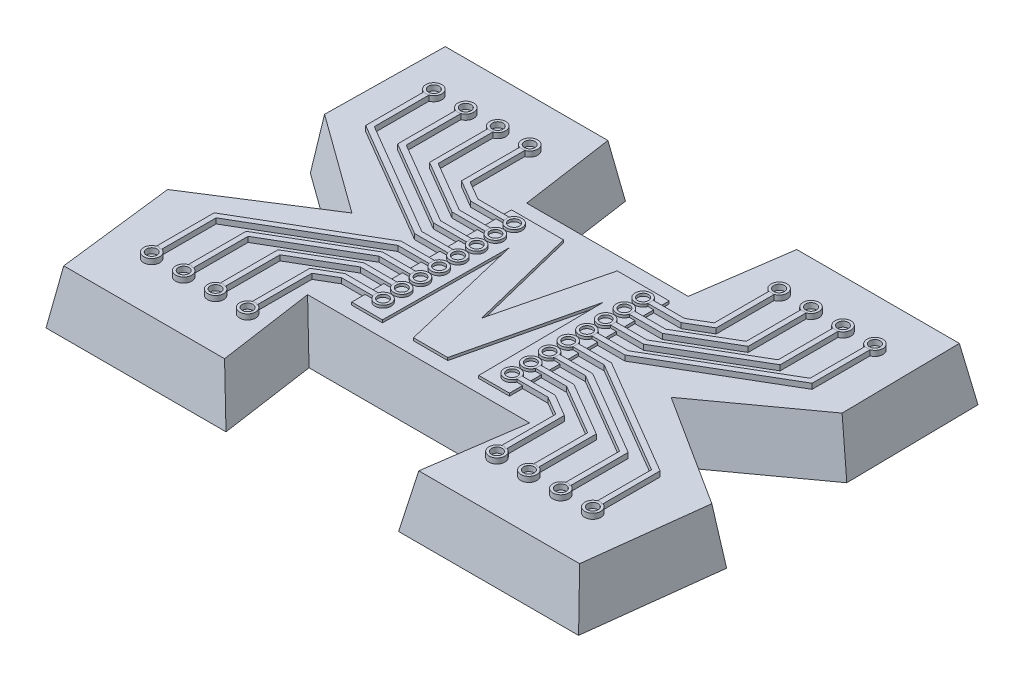
from build123d import *

# Parameters (mm, degrees)
EXTRUDE_X_DEPTH      = 20
EXTRUDE_X_TAPER      = 10
EXTRUDE_M_DEPTH      = 1
EXTRUDE_M_DEPTH_BACK = 7
M_HOLES_DEPTH        = 1
M_HOLES_DEPTH_BACK   = 3
SKETCH_9_R           = 3
SKETCH_9_R_2         = 2
HOLES_DEPTH          = 2
HOLES_DEPTH_BACK     = 4
SKETCH_8_R           = 3
SKETCH_8_R_2         = 2
HOLES_2_DEPTH        = 2
HOLES_2_DEPTH_BACK   = 4
HOLES_3_DEPTH        = 2
HOLES_3_DEPTH_BACK   = 4
HOLES_4_DEPTH        = 2
HOLES_4_DEPTH_BACK   = 4
HOLES_5_DEPTH        = 2
HOLES_5_DEPTH_BACK   = 4
HOLES_6_DEPTH        = 2
HOLES_6_DEPTH_BACK   = 4
HOLES_7_DEPTH        = 2
HOLES_7_DEPTH_BACK   = 4
HOLES_8_DEPTH        = 2
HOLES_8_DEPTH_BACK   = 4
HOLES_9_DEPTH        = 2
HOLES_9_DEPTH_BACK   = 4
HOLES_10_DEPTH       = 2
HOLES_10_DEPTH_BACK  = 4
HOLES_11_DEPTH       = 2
HOLES_11_DEPTH_BACK  = 4
HOLES_12_DEPTH       = 2
HOLES_12_DEPTH_BACK  = 4
HOLES_13_DEPTH       = 2
HOLES_13_DEPTH_BACK  = 4
HOLES_14_DEPTH       = 2
HOLES_14_DEPTH_BACK  = 4
HOLES_15_DEPTH       = 2
HOLES_15_DEPTH_BACK  = 4
HOLES_16_DEPTH       = 2
HOLES_16_DEPTH_BACK  = 4
ROUTES_DEPTH         = 2
ROUTES_2_DEPTH       = 2
ROUTES_3_DEPTH       = 2
ROUTES_4_DEPTH       = 2
ROUTES_5_DEPTH       = 2
ROUTES_6_DEPTH       = 2
ROUTES_7_DEPTH       = 2
ROUTES_8_DEPTH       = 2
ROUTES_9_DEPTH       = 2
ROUTES_10_DEPTH      = 2
ROUTES_11_DEPTH      = 2
ROUTES_12_DEPTH      = 2
ROUTES_13_DEPTH      = 2
ROUTES_14_DEPTH      = 2
ROUTES_15_DEPTH      = 2
ROUTES_16_DEPTH      = 2


with BuildPart() as part:
    # Эскиз1 → X (new body)
    with BuildSketch(Plane(origin=(0, 0, 0), x_dir=(1, 0, 0), z_dir=(0, 1, 0))):
        Polygon((0, 0), (67.599623535, 0), (62.359926215, 36.418021698), (137.640073785, 36.418021698), (132.400376465, 0), (200, 0), (205.94831436, 49.644914707), (166.200188233, 75), (200.728651396, 100.00530961), (200, 150), (132.400376465, 150), (127.274162693, 114.370734989), (72.725837307, 114.370734989), (67.599623535, 150), (0, 150), (-0.728651396, 100.00530961), (33.799811767, 75), (-5.94831436, 49.644914707), align=None)
    extrude(amount=EXTRUDE_X_DEPTH, taper=EXTRUDE_X_TAPER)



with BuildPart() as body_2:
    # Эскиз6 → M (new, two sides: drawn at the far end of the back side and taken through both)
    with BuildSketch(Plane(origin=(0, 20, 0), x_dir=(1, 0, 0), z_dir=(0, 1, 0)).offset(-EXTRUDE_M_DEPTH_BACK)):
        Polygon((70, 104.815168782), (70, 44.815168782), (81.538461538, 44.815168782), (81.923076923, 92.050745705), (93.185096154, 44.815168782), (106.045673077, 44.815168782), (117.307692308, 92.050745705), (117.692307692, 44.815168782), (129.230769231, 44.815168782), (129.230769231, 104.815168782), (109.711538462, 104.815168782), (99.615384615, 63.889688013), (89.519230769, 104.815168782), align=None)
    extrude(amount=EXTRUDE_M_DEPTH + EXTRUDE_M_DEPTH_BACK)


with BuildPart() as part_1:
    add(part.part)

    add(body_2.part)  # M holes merges body 2
    # Эскиз9 → M holes (add, two sides: drawn at the far end of the back side and taken through both)
    # profile 1 of 16: a face of its own
    with BuildSketch(Plane(origin=(0, 21, 0), x_dir=(1, 0, 0), z_dir=(0, 1, 0)).offset(-M_HOLES_DEPTH_BACK)):
        with Locations((75.769230769, 50.815168782)):
            Circle(SKETCH_9_R)
        with Locations((75.769230769, 50.815168782)):
            Circle(SKETCH_9_R_2, mode=Mode.SUBTRACT)
    # profile 2 of 16: a face of its own
    with BuildSketch(Plane(origin=(0, 21, 0), x_dir=(1, 0, 0), z_dir=(0, 1, 0)).offset(-M_HOLES_DEPTH_BACK)):
        with Locations((75.769230769, 57.841573241)):
            Circle(SKETCH_9_R)
        with Locations((75.769230769, 57.841573241)):
            Circle(SKETCH_9_R_2, mode=Mode.SUBTRACT)
    # profile 3 of 16: a face of its own
    with BuildSketch(Plane(origin=(0, 21, 0), x_dir=(1, 0, 0), z_dir=(0, 1, 0)).offset(-M_HOLES_DEPTH_BACK)):
        with Locations((75.769230769, 64.867977701)):
            Circle(SKETCH_9_R)
        with Locations((75.769230769, 64.867977701)):
            Circle(SKETCH_9_R_2, mode=Mode.SUBTRACT)
    # profile 4 of 16: a face of its own
    with BuildSketch(Plane(origin=(0, 21, 0), x_dir=(1, 0, 0), z_dir=(0, 1, 0)).offset(-M_HOLES_DEPTH_BACK)):
        with Locations((75.769230769, 71.894382161)):
            Circle(SKETCH_9_R)
        with Locations((75.769230769, 71.894382161)):
            Circle(SKETCH_9_R_2, mode=Mode.SUBTRACT)
    # profile 5 of 16: a face of its own
    with BuildSketch(Plane(origin=(0, 21, 0), x_dir=(1, 0, 0), z_dir=(0, 1, 0)).offset(-M_HOLES_DEPTH_BACK)):
        with Locations((75.769230769, 78.920786621)):
            Circle(SKETCH_9_R)
        with Locations((75.769230769, 78.920786621)):
            Circle(SKETCH_9_R_2, mode=Mode.SUBTRACT)
    # profile 6 of 16: a face of its own
    with BuildSketch(Plane(origin=(0, 21, 0), x_dir=(1, 0, 0), z_dir=(0, 1, 0)).offset(-M_HOLES_DEPTH_BACK)):
        with Locations((75.769230769, 85.94719108)):
            Circle(SKETCH_9_R)
        with Locations((75.769230769, 85.94719108)):
            Circle(SKETCH_9_R_2, mode=Mode.SUBTRACT)
    # profile 7 of 16: a face of its own
    with BuildSketch(Plane(origin=(0, 21, 0), x_dir=(1, 0, 0), z_dir=(0, 1, 0)).offset(-M_HOLES_DEPTH_BACK)):
        with Locations((75.769230769, 92.97359554)):
            Circle(SKETCH_9_R)
        with Locations((75.769230769, 92.97359554)):
            Circle(SKETCH_9_R_2, mode=Mode.SUBTRACT)
    # profile 8 of 16: a face of its own
    with BuildSketch(Plane(origin=(0, 21, 0), x_dir=(1, 0, 0), z_dir=(0, 1, 0)).offset(-M_HOLES_DEPTH_BACK)):
        with Locations((75.769230769, 100)):
            Circle(SKETCH_9_R)
        with Locations((75.769230769, 100)):
            Circle(SKETCH_9_R_2, mode=Mode.SUBTRACT)
    # profile 9 of 16: a face of its own
    with BuildSketch(Plane(origin=(0, 21, 0), x_dir=(1, 0, 0), z_dir=(0, 1, 0)).offset(-M_HOLES_DEPTH_BACK)):
        with Locations((124.230769231, 100)):
            Circle(SKETCH_9_R)
        with Locations((124.230769231, 100)):
            Circle(SKETCH_9_R_2, mode=Mode.SUBTRACT)
    # profile 10 of 16: a face of its own
    with BuildSketch(Plane(origin=(0, 21, 0), x_dir=(1, 0, 0), z_dir=(0, 1, 0)).offset(-M_HOLES_DEPTH_BACK)):
        with Locations((124.230769231, 92.97359554)):
            Circle(SKETCH_9_R)
        with Locations((124.230769231, 92.97359554)):
            Circle(SKETCH_9_R_2, mode=Mode.SUBTRACT)
    # profile 11 of 16: a face of its own
    with BuildSketch(Plane(origin=(0, 21, 0), x_dir=(1, 0, 0), z_dir=(0, 1, 0)).offset(-M_HOLES_DEPTH_BACK)):
        with Locations((124.230769231, 85.94719108)):
            Circle(SKETCH_9_R)
        with Locations((124.230769231, 85.94719108)):
            Circle(SKETCH_9_R_2, mode=Mode.SUBTRACT)
    # profile 12 of 16: a face of its own
    with BuildSketch(Plane(origin=(0, 21, 0), x_dir=(1, 0, 0), z_dir=(0, 1, 0)).offset(-M_HOLES_DEPTH_BACK)):
        with Locations((124.230769231, 78.920786621)):
            Circle(SKETCH_9_R)
        with Locations((124.230769231, 78.920786621)):
            Circle(SKETCH_9_R_2, mode=Mode.SUBTRACT)
    # profile 13 of 16: a face of its own
    with BuildSketch(Plane(origin=(0, 21, 0), x_dir=(1, 0, 0), z_dir=(0, 1, 0)).offset(-M_HOLES_DEPTH_BACK)):
        with Locations((124.230769231, 71.894382161)):
            Circle(SKETCH_9_R)
        with Locations((124.230769231, 71.894382161)):
            Circle(SKETCH_9_R_2, mode=Mode.SUBTRACT)
    # profile 14 of 16: a face of its own
    with BuildSketch(Plane(origin=(0, 21, 0), x_dir=(1, 0, 0), z_dir=(0, 1, 0)).offset(-M_HOLES_DEPTH_BACK)):
        with Locations((124.230769231, 64.867977701)):
            Circle(SKETCH_9_R)
        with Locations((124.230769231, 64.867977701)):
            Circle(SKETCH_9_R_2, mode=Mode.SUBTRACT)
    # profile 15 of 16: a face of its own
    with BuildSketch(Plane(origin=(0, 21, 0), x_dir=(1, 0, 0), z_dir=(0, 1, 0)).offset(-M_HOLES_DEPTH_BACK)):
        with Locations((124.230769231, 57.841573241)):
            Circle(SKETCH_9_R)
        with Locations((124.230769231, 57.841573241)):
            Circle(SKETCH_9_R_2, mode=Mode.SUBTRACT)
    # profile 16 of 16: a face of its own
    with BuildSketch(Plane(origin=(0, 21, 0), x_dir=(1, 0, 0), z_dir=(0, 1, 0)).offset(-M_HOLES_DEPTH_BACK)):
        with Locations((124.230769231, 50.815168782)):
            Circle(SKETCH_9_R)
        with Locations((124.230769231, 50.815168782)):
            Circle(SKETCH_9_R_2, mode=Mode.SUBTRACT)
    extrude(amount=M_HOLES_DEPTH + M_HOLES_DEPTH_BACK)


with BuildPart() as body_2_2:
    # Эскиз8 → holes (new, two sides: drawn at the far end of the back side and taken through both)
    with BuildSketch(Plane(origin=(0, 20, 0), x_dir=(1, 0, 0), z_dir=(0, 1, 0)).offset(-HOLES_DEPTH_BACK)):
        with Locations((17.173553725, 128.473460386)):
            Circle(SKETCH_8_R)
        with Locations((17.173553725, 128.473460386)):
            Circle(SKETCH_8_R_2, mode=Mode.SUBTRACT)
    extrude(amount=HOLES_DEPTH + HOLES_DEPTH_BACK)


with BuildPart() as body_3:
    # Эскиз8 → holes 2 (new, two sides: drawn at the far end of the back side and taken through both)
    with BuildSketch(Plane(origin=(0, 20, 0), x_dir=(1, 0, 0), z_dir=(0, 1, 0)).offset(-HOLES_2_DEPTH_BACK)):
        with Locations((29.173553725, 128.473460386)):
            Circle(SKETCH_8_R)
        with Locations((29.173553725, 128.473460386)):
            Circle(SKETCH_8_R_2, mode=Mode.SUBTRACT)
    extrude(amount=HOLES_2_DEPTH + HOLES_2_DEPTH_BACK)


with BuildPart() as body_4:
    # Эскиз8 → holes 3 (new, two sides: drawn at the far end of the back side and taken through both)
    with BuildSketch(Plane(origin=(0, 20, 0), x_dir=(1, 0, 0), z_dir=(0, 1, 0)).offset(-HOLES_3_DEPTH_BACK)):
        with Locations((41.173553725, 128.473460386)):
            Circle(SKETCH_8_R)
        with Locations((41.173553725, 128.473460386)):
            Circle(SKETCH_8_R_2, mode=Mode.SUBTRACT)
    extrude(amount=HOLES_3_DEPTH + HOLES_3_DEPTH_BACK)


with BuildPart() as body_5:
    # Эскиз8 → holes 4 (new, two sides: drawn at the far end of the back side and taken through both)
    with BuildSketch(Plane(origin=(0, 20, 0), x_dir=(1, 0, 0), z_dir=(0, 1, 0)).offset(-HOLES_4_DEPTH_BACK)):
        with Locations((53.173553725, 128.473460386)):
            Circle(SKETCH_8_R)
        with Locations((53.173553725, 128.473460386)):
            Circle(SKETCH_8_R_2, mode=Mode.SUBTRACT)
    extrude(amount=HOLES_4_DEPTH + HOLES_4_DEPTH_BACK)


with BuildPart() as body_6:
    # Эскиз8 → holes 5 (new, two sides: drawn at the far end of the back side and taken through both)
    with BuildSketch(Plane(origin=(0, 20, 0), x_dir=(1, 0, 0), z_dir=(0, 1, 0)).offset(-HOLES_5_DEPTH_BACK)):
        with Locations((182.826446275, 22.526539614)):
            Circle(SKETCH_8_R)
        with Locations((182.826446275, 22.526539614)):
            Circle(SKETCH_8_R_2, mode=Mode.SUBTRACT)
    extrude(amount=HOLES_5_DEPTH + HOLES_5_DEPTH_BACK)


with BuildPart() as body_7:
    # Эскиз8 → holes 6 (new, two sides: drawn at the far end of the back side and taken through both)
    with BuildSketch(Plane(origin=(0, 20, 0), x_dir=(1, 0, 0), z_dir=(0, 1, 0)).offset(-HOLES_6_DEPTH_BACK)):
        with Locations((170.826446275, 22.526539614)):
            Circle(SKETCH_8_R)
        with Locations((170.826446275, 22.526539614)):
            Circle(SKETCH_8_R_2, mode=Mode.SUBTRACT)
    extrude(amount=HOLES_6_DEPTH + HOLES_6_DEPTH_BACK)


with BuildPart() as body_8:
    # Эскиз8 → holes 7 (new, two sides: drawn at the far end of the back side and taken through both)
    with BuildSketch(Plane(origin=(0, 20, 0), x_dir=(1, 0, 0), z_dir=(0, 1, 0)).offset(-HOLES_7_DEPTH_BACK)):
        with Locations((158.826446275, 22.526539614)):
            Circle(SKETCH_8_R)
        with Locations((158.826446275, 22.526539614)):
            Circle(SKETCH_8_R_2, mode=Mode.SUBTRACT)
    extrude(amount=HOLES_7_DEPTH + HOLES_7_DEPTH_BACK)


with BuildPart() as body_9:
    # Эскиз8 → holes 8 (new, two sides: drawn at the far end of the back side and taken through both)
    with BuildSketch(Plane(origin=(0, 20, 0), x_dir=(1, 0, 0), z_dir=(0, 1, 0)).offset(-HOLES_8_DEPTH_BACK)):
        with Locations((146.826446275, 22.526539614)):
            Circle(SKETCH_8_R)
        with Locations((146.826446275, 22.526539614)):
            Circle(SKETCH_8_R_2, mode=Mode.SUBTRACT)
    extrude(amount=HOLES_8_DEPTH + HOLES_8_DEPTH_BACK)


with BuildPart() as body_10:
    # Эскиз8 → holes 9 (new, two sides: drawn at the far end of the back side and taken through both)
    with BuildSketch(Plane(origin=(0, 20, 0), x_dir=(1, 0, 0), z_dir=(0, 1, 0)).offset(-HOLES_9_DEPTH_BACK)):
        with Locations((53.173553725, 22.526539614)):
            Circle(SKETCH_8_R)
        with Locations((53.173553725, 22.526539614)):
            Circle(SKETCH_8_R_2, mode=Mode.SUBTRACT)
    extrude(amount=HOLES_9_DEPTH + HOLES_9_DEPTH_BACK)


with BuildPart() as body_11:
    # Эскиз8 → holes 10 (new, two sides: drawn at the far end of the back side and taken through both)
    with BuildSketch(Plane(origin=(0, 20, 0), x_dir=(1, 0, 0), z_dir=(0, 1, 0)).offset(-HOLES_10_DEPTH_BACK)):
        with Locations((41.173553725, 22.526539614)):
            Circle(SKETCH_8_R)
        with Locations((41.173553725, 22.526539614)):
            Circle(SKETCH_8_R_2, mode=Mode.SUBTRACT)
    extrude(amount=HOLES_10_DEPTH + HOLES_10_DEPTH_BACK)


with BuildPart() as body_12:
    # Эскиз8 → holes 11 (new, two sides: drawn at the far end of the back side and taken through both)
    with BuildSketch(Plane(origin=(0, 20, 0), x_dir=(1, 0, 0), z_dir=(0, 1, 0)).offset(-HOLES_11_DEPTH_BACK)):
        with Locations((29.173553725, 22.526539614)):
            Circle(SKETCH_8_R)
        with Locations((29.173553725, 22.526539614)):
            Circle(SKETCH_8_R_2, mode=Mode.SUBTRACT)
    extrude(amount=HOLES_11_DEPTH + HOLES_11_DEPTH_BACK)


with BuildPart() as body_13:
    # Эскиз8 → holes 12 (new, two sides: drawn at the far end of the back side and taken through both)
    with BuildSketch(Plane(origin=(0, 20, 0), x_dir=(1, 0, 0), z_dir=(0, 1, 0)).offset(-HOLES_12_DEPTH_BACK)):
        with Locations((17.173553725, 22.526539614)):
            Circle(SKETCH_8_R)
        with Locations((17.173553725, 22.526539614)):
            Circle(SKETCH_8_R_2, mode=Mode.SUBTRACT)
    extrude(amount=HOLES_12_DEPTH + HOLES_12_DEPTH_BACK)


with BuildPart() as body_14:
    # Эскиз8 → holes 13 (new, two sides: drawn at the far end of the back side and taken through both)
    with BuildSketch(Plane(origin=(0, 20, 0), x_dir=(1, 0, 0), z_dir=(0, 1, 0)).offset(-HOLES_13_DEPTH_BACK)):
        with Locations((146.826446275, 128.473460386)):
            Circle(SKETCH_8_R)
        with Locations((146.826446275, 128.473460386)):
            Circle(SKETCH_8_R_2, mode=Mode.SUBTRACT)
    extrude(amount=HOLES_13_DEPTH + HOLES_13_DEPTH_BACK)


with BuildPart() as body_15:
    # Эскиз8 → holes 14 (new, two sides: drawn at the far end of the back side and taken through both)
    with BuildSketch(Plane(origin=(0, 20, 0), x_dir=(1, 0, 0), z_dir=(0, 1, 0)).offset(-HOLES_14_DEPTH_BACK)):
        with Locations((158.826446275, 128.473460386)):
            Circle(SKETCH_8_R)
        with Locations((158.826446275, 128.473460386)):
            Circle(SKETCH_8_R_2, mode=Mode.SUBTRACT)
    extrude(amount=HOLES_14_DEPTH + HOLES_14_DEPTH_BACK)


with BuildPart() as body_16:
    # Эскиз8 → holes 15 (new, two sides: drawn at the far end of the back side and taken through both)
    with BuildSketch(Plane(origin=(0, 20, 0), x_dir=(1, 0, 0), z_dir=(0, 1, 0)).offset(-HOLES_15_DEPTH_BACK)):
        with Locations((170.826446275, 128.473460386)):
            Circle(SKETCH_8_R)
        with Locations((170.826446275, 128.473460386)):
            Circle(SKETCH_8_R_2, mode=Mode.SUBTRACT)
    extrude(amount=HOLES_15_DEPTH + HOLES_15_DEPTH_BACK)


with BuildPart() as body_17:
    # Эскиз8 → holes 16 (new, two sides: drawn at the far end of the back side and taken through both)
    with BuildSketch(Plane(origin=(0, 20, 0), x_dir=(1, 0, 0), z_dir=(0, 1, 0)).offset(-HOLES_16_DEPTH_BACK)):
        with Locations((182.826446275, 128.473460386)):
            Circle(SKETCH_8_R)
        with Locations((182.826446275, 128.473460386)):
            Circle(SKETCH_8_R_2, mode=Mode.SUBTRACT)
    extrude(amount=HOLES_16_DEPTH + HOLES_16_DEPTH_BACK)


with BuildPart() as body_18:
    # Эскиз10 → routes (new body)
    with BuildSketch(Plane(origin=(0, 20, 0), x_dir=(1, 0, 0), z_dir=(0, 1, 0))):
        with BuildLine():
            Line((72.940803644, 79.920786621), (72.940803644, 77.920786621))
            Line((72.940803644, 77.920786621), (60.496949336, 77.920786621))
            Line((60.496949336, 77.920786621), (16.173553725, 103.87362867))
            Line((16.173553725, 103.87362867), (16.173553725, 125.645033261))
            ThreePointArc((16.173553725, 125.645033261), (17.173553725, 125.473460386), (18.173553725, 125.645033261))
            Line((18.173553725, 125.645033261), (18.173553725, 105.117398423))
            Line((18.173553725, 105.117398423), (61.205426336, 79.920786621))
            Line((61.205426336, 79.920786621), (72.940803644, 79.920786621))
        make_face()
    extrude(amount=ROUTES_DEPTH)


with BuildPart() as body_19:
    # Эскиз10 → routes 2 (new body)
    with BuildSketch(Plane(origin=(0, 20, 0), x_dir=(1, 0, 0), z_dir=(0, 1, 0))):
        Polygon((72.940803644, 84.94719108), (72.940803644, 86.94719108), (61.203215137, 86.94719108), (30.173553725, 105.116103691), (30.173553725, 125.645033261), (28.173553725, 125.645033261), (28.173553725, 103.874923402), (60.499160535, 84.94719108), align=None)
    extrude(amount=ROUTES_2_DEPTH)


with BuildPart() as body_20:
    # Эскиз10 → routes 3 (new body)
    with BuildSketch(Plane(origin=(0, 20, 0), x_dir=(1, 0, 0), z_dir=(0, 1, 0))):
        Polygon((72.940803644, 91.97359554), (72.940803644, 93.97359554), (61.209541784, 93.97359554), (42.173553725, 105.119808156), (42.173553725, 125.645033261), (40.173553725, 125.645033261), (40.173553725, 103.871218937), (60.492833888, 91.97359554), align=None)
    extrude(amount=ROUTES_3_DEPTH)


with BuildPart() as body_21:
    # Эскиз10 → routes 4 (new body)
    with BuildSketch(Plane(origin=(0, 20, 0), x_dir=(1, 0, 0), z_dir=(0, 1, 0))):
        Polygon((72.940803644, 99), (72.940803644, 101), (61.200836005, 101), (54.173553725, 105.114710629), (54.173553725, 125.645033261), (52.173553725, 125.645033261), (52.173553725, 103.876316463), (60.501539667, 99), align=None)
    extrude(amount=ROUTES_4_DEPTH)


with BuildPart() as body_22:
    # Эскиз10 → routes 5 (new body)
    with BuildSketch(Plane(origin=(0, 20, 0), x_dir=(1, 0, 0), z_dir=(0, 1, 0))):
        Polygon((127.059196356, 99), (139.498460333, 99), (147.826446275, 103.876316463), (147.826446275, 125.645033261), (145.826446275, 125.645033261), (145.826446275, 105.114710629), (138.799163995, 101), (127.059196356, 101), align=None)
    extrude(amount=ROUTES_5_DEPTH)


with BuildPart() as body_23:
    # Эскиз10 → routes 6 (new body)
    with BuildSketch(Plane(origin=(0, 20, 0), x_dir=(1, 0, 0), z_dir=(0, 1, 0))):
        Polygon((127.059196356, 91.97359554), (139.507166112, 91.97359554), (159.826446275, 103.871218937), (159.826446275, 125.645033261), (157.826446275, 125.645033261), (157.826446275, 105.119808156), (138.790458216, 93.97359554), (127.059196356, 93.97359554), align=None)
    extrude(amount=ROUTES_6_DEPTH)


with BuildPart() as body_24:
    # Эскиз10 → routes 7 (new body)
    with BuildSketch(Plane(origin=(0, 20, 0), x_dir=(1, 0, 0), z_dir=(0, 1, 0))):
        Polygon((127.059196356, 84.94719108), (139.500839465, 84.94719108), (171.826446275, 103.874923402), (171.826446275, 125.645033261), (169.826446275, 125.645033261), (169.826446275, 105.116103691), (138.796784863, 86.94719108), (127.059196356, 86.94719108), align=None)
    extrude(amount=ROUTES_7_DEPTH)


with BuildPart() as body_25:
    # Эскиз10 → routes 8 (new body)
    with BuildSketch(Plane(origin=(0, 20, 0), x_dir=(1, 0, 0), z_dir=(0, 1, 0))):
        Polygon((183.826446275, 125.645033261), (183.826446275, 103.87362867), (139.503050664, 77.920786621), (127.059196356, 77.920786621), (127.059196356, 79.920786621), (138.794573664, 79.920786621), (181.826446275, 105.117398423), (181.826446275, 125.645033261), align=None)
    extrude(amount=ROUTES_8_DEPTH)


with BuildPart() as body_26:
    # Эскиз10 → routes 9 (new body)
    with BuildSketch(Plane(origin=(0, 20, 0), x_dir=(1, 0, 0), z_dir=(0, 1, 0))):
        Polygon((127.054246393, 70.83847762), (127.056426438, 72.838476432), (139.500273355, 72.824912349), (183.795353449, 46.823772214), (183.771622125, 25.052380557), (181.771623314, 25.054560602), (181.7939989, 45.582183245), (138.789616729, 70.825685793), align=None)
    extrude(amount=ROUTES_9_DEPTH)


with BuildPart() as body_27:
    # Эскиз10 → routes 10 (new body)
    with BuildSketch(Plane(origin=(0, 20, 0), x_dir=(1, 0, 0), z_dir=(0, 1, 0))):
        Polygon((127.048767498, 65.812076146), (127.046587453, 63.812077334), (138.784168988, 63.799283097), (169.79400744, 45.596558247), (169.771630442, 25.067640873), (171.771629254, 25.065460828), (171.795359166, 46.835557754), (139.490403216, 65.798514474), align=None)
    extrude(amount=ROUTES_10_DEPTH)


with BuildPart() as body_28:
    # Эскиз10 → routes 11 (new body)
    with BuildSketch(Plane(origin=(0, 20, 0), x_dir=(1, 0, 0), z_dir=(0, 1, 0))):
        Polygon((127.041108559, 58.78567586), (127.038928513, 56.785677049), (138.770183405, 56.772889708), (157.794010531, 45.605934056), (157.771637571, 25.080721145), (159.771636383, 25.078541099), (159.795370333, 46.852342489), (139.48907092, 58.772107292), align=None)
    extrude(amount=ROUTES_11_DEPTH)


with BuildPart() as body_29:
    # Эскиз10 → routes 12 (new body)
    with BuildSketch(Plane(origin=(0, 20, 0), x_dir=(1, 0, 0), z_dir=(0, 1, 0))):
        Polygon((127.033449619, 51.759275575), (127.031269574, 49.759276763), (138.771230238, 49.746479933), (145.794023216, 45.624111851), (145.7716447, 25.093801416), (147.771643512, 25.091621371), (147.795371906, 46.860325236), (139.472706207, 51.745716496), align=None)
    extrude(amount=ROUTES_12_DEPTH)


with BuildPart() as body_30:
    # Эскиз10 → routes 13 (new body)
    with BuildSketch(Plane(origin=(0, 20, 0), x_dir=(1, 0, 0), z_dir=(0, 1, 0))):
        Polygon((72.915089058, 51.818265847), (60.47583247, 51.831824926), (52.142536181, 46.964589053), (52.118807787, 25.195885187), (54.118806599, 25.193705142), (54.141185115, 45.724015577), (61.172948348, 49.831063865), (72.912909013, 49.818267035), align=None)
    extrude(amount=ROUTES_13_DEPTH)


with BuildPart() as body_31:
    # Эскиз10 → routes 14 (new body)
    with BuildSketch(Plane(origin=(0, 20, 0), x_dir=(1, 0, 0), z_dir=(0, 1, 0))):
        Polygon((72.922747998, 58.844666132), (60.474785637, 58.858234701), (40.142548866, 46.982766848), (40.118814916, 25.208965458), (42.118813728, 25.206785413), (42.141186687, 45.731998325), (61.189313061, 56.857454661), (72.920567953, 56.844667321), align=None)
    extrude(amount=ROUTES_14_DEPTH)


with BuildPart() as body_32:
    # Эскиз10 → routes 15 (new body)
    with BuildSketch(Plane(origin=(0, 20, 0), x_dir=(1, 0, 0), z_dir=(0, 1, 0))):
        Polygon((72.930406938, 65.871066418), (60.48877122, 65.88462809), (28.142551957, 46.992142656), (28.118822045, 25.22204573), (30.118820857, 25.219865685), (30.141197854, 45.748783059), (61.190645358, 63.883861843), (72.928226893, 63.871067606), align=None)
    extrude(amount=ROUTES_15_DEPTH)


with BuildPart() as body_33:
    # Эскиз10 → routes 16 (new body)
    with BuildSketch(Plane(origin=(0, 20, 0), x_dir=(1, 0, 0), z_dir=(0, 1, 0))):
        Polygon((16.118829174, 25.235126001), (16.142560497, 47.006517659), (60.494218961, 72.911030786), (72.938065878, 72.897466704), (72.935885832, 70.897467892), (61.200515496, 70.910259718), (18.141203572, 45.760568599), (18.118827986, 25.232945956), align=None)
    extrude(amount=ROUTES_16_DEPTH)


solid = Compound([part_1.part, body_2_2.part, body_3.part, body_4.part, body_5.part, body_6.part, body_7.part, body_8.part, body_9.part, body_10.part, body_11.part, body_12.part, body_13.part, body_14.part, body_15.part, body_16.part, body_17.part, body_18.part, body_19.part, body_20.part, body_21.part, body_22.part, body_23.part, body_24.part, body_25.part, body_26.part, body_27.part, body_28.part, body_29.part, body_30.part, body_31.part, body_32.part, body_33.part])
